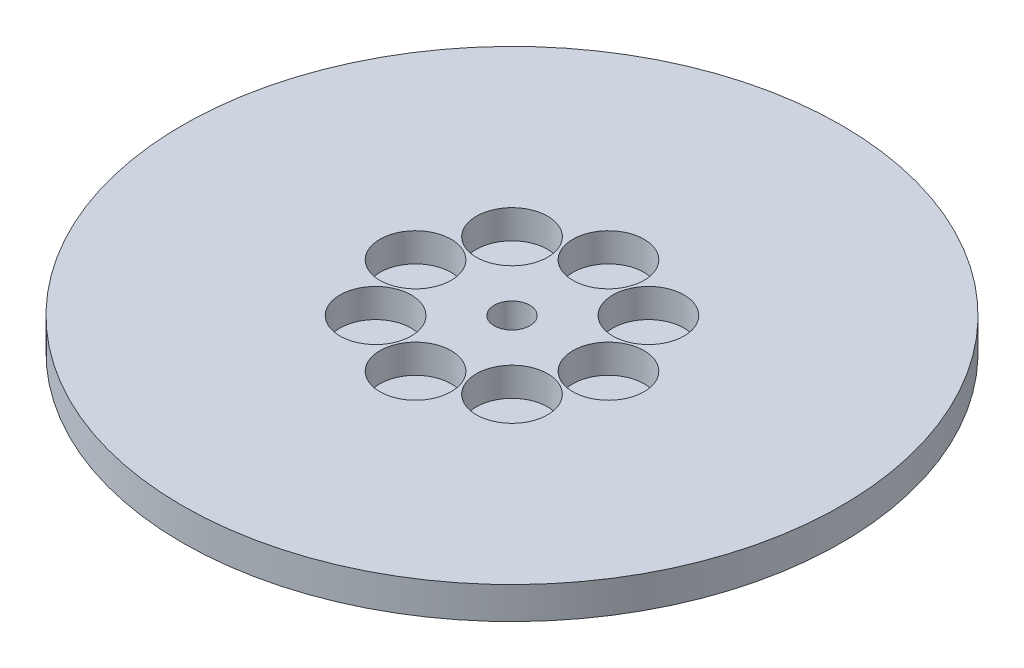
from build123d import *

# Parameters (mm, degrees)
SKETCH1_R           = 92.5
BOSS_EXTRUDE1_DEPTH = 9
SKETCH2_R           = 5
CUT_EXTRUDE1_DEPTH  = 132.123987127
SKETCH3_R           = 10
CUT_EXTRUDE2_DEPTH  = 8.064238178
CIRPATTERN1_COUNT   = 8


with BuildPart() as part:
    # Sketch1 → Boss-Extrude1 (new body)
    with BuildSketch(Plane(origin=(0, 0, 0), x_dir=(1, 0, 0), z_dir=(0, 1, 0))):
        Circle(SKETCH1_R)
    extrude(amount=BOSS_EXTRUDE1_DEPTH)

    # Sketch2 → Cut-Extrude1 (cut, through all)
    with BuildSketch(Plane(origin=(0, 0, 0), x_dir=(1, 0, 0), z_dir=(0, 1, 0))):
        Circle(SKETCH2_R)
    extrude(amount=CUT_EXTRUDE1_DEPTH, mode=Mode.SUBTRACT)

    # Sketch3 → Cut-Extrude2 (cut)
    with BuildSketch(Plane(origin=(0, 9, 0), x_dir=(1, 0, 0), z_dir=(0, 1, 0))):
        with Locations((-27.076389824, 0)):
            Circle(SKETCH3_R)
    cut_extrude2 = extrude(amount=-CUT_EXTRUDE2_DEPTH, mode=Mode.SUBTRACT)

    # CirPattern1: Cut-Extrude2 ×8 about axis
    cirpattern1_axis = Axis((0, 0, 0), (0, 1, 0))
    for i in range(1, CIRPATTERN1_COUNT):
        add(cut_extrude2.rotate(cirpattern1_axis, i * 360 / CIRPATTERN1_COUNT), mode=Mode.SUBTRACT)


solid = part.part
